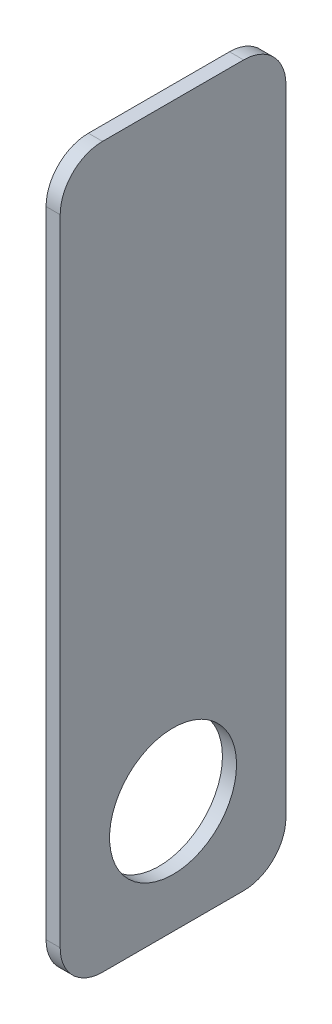
from build123d import *

# Parameters (mm, degrees)
SKETCH1_W           = 50.8
SKETCH1_H           = 161.925
SKETCH1_R           = 14.2875
BOSS_EXTRUDE1_DEPTH = 3.175
FILLET1_R           = 9.525


with BuildPart() as part:
    # Sketch1 → Boss-Extrude1 (new body)
    with BuildSketch(Plane(origin=(0, 0, 0), x_dir=(0, 0, -1), z_dir=(1, 0, 0))):
        Rectangle(SKETCH1_W, SKETCH1_H)
        with Locations((0, -55.5625)):
            Circle(SKETCH1_R, mode=Mode.SUBTRACT)
    extrude(amount=BOSS_EXTRUDE1_DEPTH)

    # Fillet1
    fillet1_edges = [part.edges().sort_by_distance(p)[0] for p in [
        (1.5875, -80.9625, -25.4),
        (1.5875, -80.9625, 25.4),
        (1.5875, 80.9625, -25.4),
        (1.5875, 80.9625, 25.4),
    ]]
    fillet(fillet1_edges, radius=FILLET1_R)


solid = part.part
